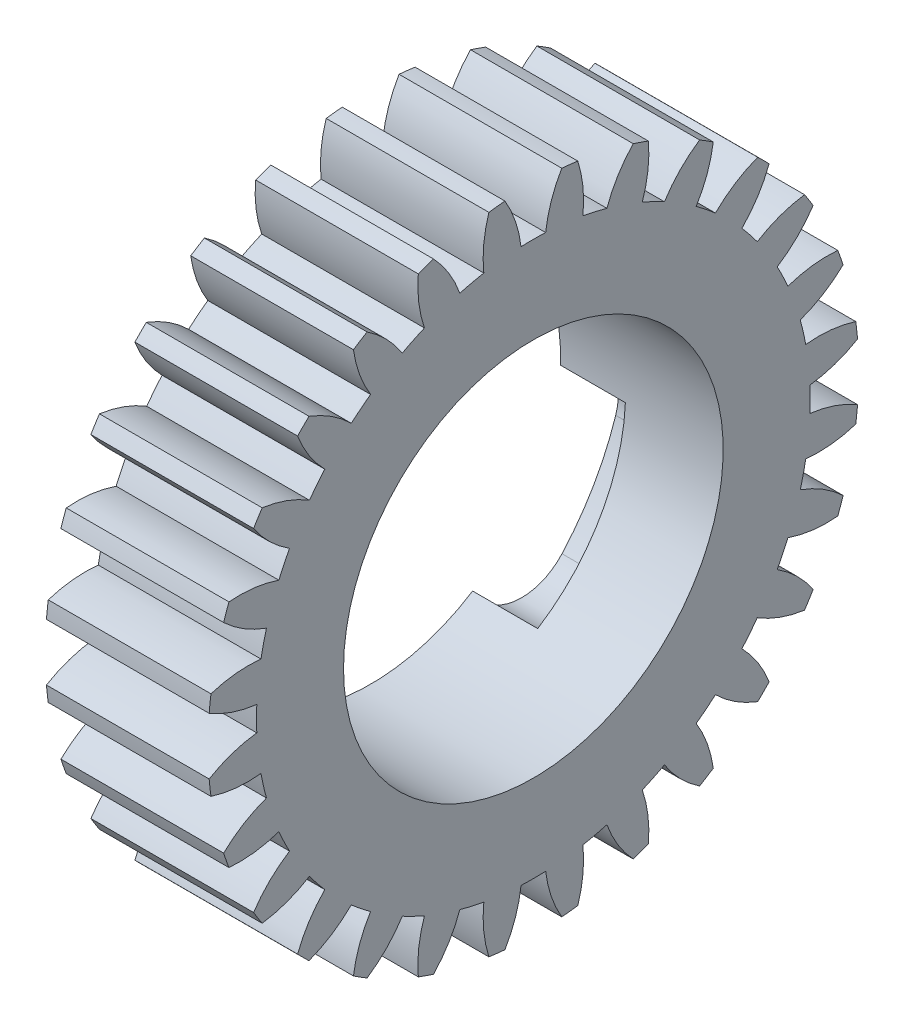
from build123d import *

# Parameters (mm, degrees)
SPUR_START             = -39.976574344
SPUR_GEAR_AI_OUTLINE_R = 11.1125
SPUR_GEAR_AI_DEPTH     = 9.525
CUT_EXTRUDE1_DEPTH     = 3.81
FILLET1_R              = 3.175


# Read off the part's stored shape, not the designer's step: spur gear_ai
with BuildPart() as part:
    # spur gear_ai outline → spur gear_ai (new body)
    with BuildSketch(Plane.YZ.offset(SPUR_START)):
        with BuildLine():
            ThreePointArc((23.018012861, 10.828162447), (23.179360033, 11.271572893), (23.329675625, 11.718843456))
            ThreePointArc((23.329675625, 11.718843456), (22.156058235, 12.619945917), (20.821383651, 13.258700312))
            ThreePointArc((20.821383651, 13.258700312), (20.997284393, 13.957392784), (21.141954603, 14.663213422))
            ThreePointArc((21.141954603, 14.663213422), (22.621599998, 14.659617646), (24.069966434, 14.96226941))
            ThreePointArc((24.069966434, 14.96226941), (24.128600189, 15.430465753), (24.175619992, 15.899970675))
            ThreePointArc((24.175619992, 15.899970675), (22.83091348, 16.517326179), (21.387565749, 16.843072632))
            ThreePointArc((21.387565749, 16.843072632), (21.40358259, 17.563389023), (21.387565749, 18.283705414))
            ThreePointArc((21.387565749, 18.283705414), (22.83091348, 18.609451867), (24.175619992, 19.226807371))
            ThreePointArc((24.175619992, 19.226807371), (24.128600189, 19.696312293), (24.069966434, 20.164508637))
            ThreePointArc((24.069966434, 20.164508637), (22.621599998, 20.4671604), (21.141954603, 20.463564625))
            ThreePointArc((21.141954603, 20.463564625), (20.997284393, 21.169385262), (20.821383651, 21.868077734))
            ThreePointArc((20.821383651, 21.868077734), (22.156058236, 22.506832129), (23.329675625, 23.407934591))
            ThreePointArc((23.329675625, 23.407934591), (23.179360033, 23.855205153), (23.018012861, 24.298615599))
            ThreePointArc((23.018012861, 24.298615599), (21.538613642, 24.271387399), (20.096866182, 23.938629702))
            ThreePointArc((20.096866182, 23.938629702), (19.798763289, 24.594561792), (19.471799044, 25.236594988))
            ThreePointArc((19.471799044, 25.236594988), (20.630874326, 26.156327512), (21.574552516, 27.295991891))
            ThreePointArc((21.574552516, 27.295991891), (21.328478586, 27.698600081), (21.072508617, 28.094990178))
            ThreePointArc((21.072508617, 28.094990178), (19.63625987, 27.739247349), (18.304705583, 27.094013591))
            ThreePointArc((18.304705583, 27.094013591), (17.86811813, 27.66716596), (17.406485735, 28.220345654))
            ThreePointArc((17.406485735, 28.220345654), (18.331840839, 29.374937077), (18.998259865, 30.696015843))
            ThreePointArc((18.998259865, 30.696015843), (18.668766772, 31.033773205), (18.331009411, 31.363266298))
            ThreePointArc((18.331009411, 31.363266298), (17.009930645, 30.696847272), (15.855339222, 29.771492168))
            ThreePointArc((15.855339222, 29.771492168), (15.302159528, 30.233124563), (14.729007159, 30.669712016))
            ThreePointArc((14.729007159, 30.669712016), (15.374240917, 32.001266303), (15.729983745, 33.43751505))
            ThreePointArc((15.729983745, 33.43751505), (15.333593648, 33.693485018), (14.930985458, 33.939558948))
            ThreePointArc((14.930985458, 33.939558948), (13.791321079, 32.995880758), (12.871588556, 31.836805477))
            ThreePointArc((12.871588556, 31.836805477), (12.229555359, 32.163769721), (11.573623269, 32.461872615))
            ThreePointArc((11.573623269, 32.461872615), (11.906380966, 33.903620075), (11.933609167, 35.383019293))
            ThreePointArc((11.933609167, 35.383019293), (11.490198721, 35.544366466), (11.042928158, 35.694682058))
            ThreePointArc((11.042928158, 35.694682058), (10.141825696, 34.521064669), (9.503071302, 33.186390084))
            ThreePointArc((9.503071302, 33.186390084), (8.80437883, 33.362290826), (8.098558192, 33.506961036))
            ThreePointArc((8.098558192, 33.506961036), (8.102153967, 34.98660643), (7.799502204, 36.434972866))
            ThreePointArc((7.799502204, 36.434972866), (7.33130586, 36.493606622), (6.861800938, 36.540626425))
            ThreePointArc((6.861800938, 36.540626425), (6.244445435, 35.195919912), (5.918698981, 33.752572182))
            ThreePointArc((5.918698981, 33.752572182), (5.19838259, 33.768589023), (4.4780662, 33.752572182))
            ThreePointArc((4.4780662, 33.752572182), (4.152319746, 35.195919912), (3.534964243, 36.540626425))
            ThreePointArc((3.534964243, 36.540626425), (3.065459321, 36.493606622), (2.597262977, 36.434972866))
            ThreePointArc((2.597262977, 36.434972866), (2.294611214, 34.98660643), (2.298206989, 33.506961036))
            ThreePointArc((2.298206989, 33.506961036), (1.592386351, 33.362290826), (0.893693879, 33.186390084))
            ThreePointArc((0.893693879, 33.186390084), (0.254939484, 34.521064668), (-0.646162977, 35.694682058))
            ThreePointArc((-0.646162977, 35.694682058), (-1.09343354, 35.544366466), (-1.536843986, 35.383019293))
            ThreePointArc((-1.536843986, 35.383019293), (-1.509615785, 33.903620075), (-1.176858088, 32.461872615))
            ThreePointArc((-1.176858088, 32.461872615), (-1.832790178, 32.163769721), (-2.474823375, 31.836805477))
            ThreePointArc((-2.474823375, 31.836805477), (-3.394555898, 32.995880758), (-4.534220277, 33.939558948))
            ThreePointArc((-4.534220277, 33.939558948), (-4.936828467, 33.693485018), (-5.333218564, 33.43751505))
            ThreePointArc((-5.333218564, 33.43751505), (-4.977475736, 32.001266303), (-4.332241978, 30.669712016))
            ThreePointArc((-4.332241978, 30.669712016), (-4.905394347, 30.233124563), (-5.458574041, 29.771492168))
            ThreePointArc((-5.458574041, 29.771492168), (-6.613165464, 30.696847272), (-7.93424423, 31.363266298))
            ThreePointArc((-7.93424423, 31.363266298), (-8.272001591, 31.033773205), (-8.601494684, 30.696015843))
            ThreePointArc((-8.601494684, 30.696015843), (-7.935075658, 29.374937077), (-7.009720554, 28.220345654))
            ThreePointArc((-7.009720554, 28.220345654), (-7.471352949, 27.66716596), (-7.907940402, 27.094013591))
            ThreePointArc((-7.907940402, 27.094013591), (-9.239494689, 27.739247349), (-10.675743436, 28.094990178))
            ThreePointArc((-10.675743436, 28.094990178), (-10.931713405, 27.698600081), (-11.177787335, 27.295991891))
            ThreePointArc((-11.177787335, 27.295991891), (-10.234109145, 26.156327512), (-9.075033863, 25.236594988))
            ThreePointArc((-9.075033863, 25.236594988), (-9.401998108, 24.594561792), (-9.700101001, 23.938629702))
            ThreePointArc((-9.700101001, 23.938629702), (-11.141848461, 24.271387399), (-12.62124768, 24.298615599))
            ThreePointArc((-12.62124768, 24.298615599), (-12.782594852, 23.855205153), (-12.932910444, 23.407934591))
            ThreePointArc((-12.932910444, 23.407934591), (-11.759293055, 22.506832129), (-10.42461847, 21.868077734))
            ThreePointArc((-10.42461847, 21.868077734), (-10.600519212, 21.169385262), (-10.745189422, 20.463564625))
            ThreePointArc((-10.745189422, 20.463564625), (-12.224834817, 20.4671604), (-13.673201253, 20.164508637))
            ThreePointArc((-13.673201253, 20.164508637), (-13.731835008, 19.696312293), (-13.778854811, 19.226807371))
            ThreePointArc((-13.778854811, 19.226807371), (-12.434148299, 18.609451867), (-10.990800568, 18.283705414))
            ThreePointArc((-10.990800568, 18.283705414), (-11.00681741, 17.563389023), (-10.990800568, 16.843072632))
            ThreePointArc((-10.990800568, 16.843072632), (-12.434148299, 16.517326179), (-13.778854811, 15.899970675))
            ThreePointArc((-13.778854811, 15.899970675), (-13.731835008, 15.430465753), (-13.673201253, 14.96226941))
            ThreePointArc((-13.673201253, 14.96226941), (-12.224834817, 14.659617646), (-10.745189422, 14.663213422))
            ThreePointArc((-10.745189422, 14.663213422), (-10.600519212, 13.957392784), (-10.42461847, 13.258700312))
            ThreePointArc((-10.42461847, 13.258700312), (-11.759293054, 12.619945917), (-12.932910444, 11.718843456))
            ThreePointArc((-12.932910444, 11.718843456), (-12.782594852, 11.271572893), (-12.62124768, 10.828162447))
            ThreePointArc((-12.62124768, 10.828162447), (-11.141848461, 10.855390647), (-9.700101001, 11.188148344))
            ThreePointArc((-9.700101001, 11.188148344), (-9.401998108, 10.532216254), (-9.075033863, 9.890183058))
            ThreePointArc((-9.075033863, 9.890183058), (-10.234109145, 8.970450535), (-11.177787335, 7.830786156))
            ThreePointArc((-11.177787335, 7.830786156), (-10.931713405, 7.428177966), (-10.675743436, 7.031787869))
            ThreePointArc((-10.675743436, 7.031787869), (-9.239494689, 7.387530697), (-7.907940402, 8.032764455))
            ThreePointArc((-7.907940402, 8.032764455), (-7.471352949, 7.459612086), (-7.009720554, 6.906432392))
            ThreePointArc((-7.009720554, 6.906432392), (-7.935075659, 5.751840969), (-8.601494684, 4.430762203))
            ThreePointArc((-8.601494684, 4.430762203), (-8.272001591, 4.093004842), (-7.93424423, 3.763511748))
            ThreePointArc((-7.93424423, 3.763511748), (-6.613165464, 4.429930774), (-5.458574041, 5.355285878))
            ThreePointArc((-5.458574041, 5.355285878), (-4.905394347, 4.893653483), (-4.332241978, 4.457066031))
            ThreePointArc((-4.332241978, 4.457066031), (-4.977475736, 3.125511743), (-5.333218564, 1.689262996))
            ThreePointArc((-5.333218564, 1.689262996), (-4.936828467, 1.433293028), (-4.534220277, 1.187219098))
            ThreePointArc((-4.534220277, 1.187219098), (-3.394555898, 2.130897288), (-2.474823375, 3.28997257))
            ThreePointArc((-2.474823375, 3.28997257), (-1.832790179, 2.963008325), (-1.176858088, 2.664905432))
            ThreePointArc((-1.176858088, 2.664905432), (-1.509615785, 1.223157972), (-1.536843986, -0.256241247))
            ThreePointArc((-1.536843986, -0.256241247), (-1.09343354, -0.417588419), (-0.646162977, -0.567904012))
            ThreePointArc((-0.646162977, -0.567904012), (0.254939484, 0.605713378), (0.893693879, 1.940387963))
            ThreePointArc((0.893693879, 1.940387963), (1.592386351, 1.764487221), (2.298206989, 1.619817011))
            ThreePointArc((2.298206989, 1.619817011), (2.294611214, 0.140171616), (2.597262977, -1.30819482))
            ThreePointArc((2.597262977, -1.30819482), (3.065459321, -1.366828575), (3.534964243, -1.413848379))
            ThreePointArc((3.534964243, -1.413848379), (4.152319746, -0.069141866), (4.4780662, 1.374205865))
            ThreePointArc((4.4780662, 1.374205865), (5.19838259, 1.358189023), (5.918698981, 1.374205865))
            ThreePointArc((5.918698981, 1.374205865), (6.244445435, -0.069141866), (6.861800938, -1.413848379))
            ThreePointArc((6.861800938, -1.413848379), (7.33130586, -1.366828575), (7.799502204, -1.30819482))
            ThreePointArc((7.799502204, -1.30819482), (8.102153967, 0.140171616), (8.098558192, 1.619817011))
            ThreePointArc((8.098558192, 1.619817011), (8.80437883, 1.764487221), (9.503071302, 1.940387963))
            ThreePointArc((9.503071302, 1.940387963), (10.141825696, 0.605713378), (11.042928158, -0.567904012))
            ThreePointArc((11.042928158, -0.567904012), (11.490198721, -0.417588419), (11.933609167, -0.256241247))
            ThreePointArc((11.933609167, -0.256241247), (11.906380966, 1.223157972), (11.573623269, 2.664905432))
            ThreePointArc((11.573623269, 2.664905432), (12.22955536, 2.963008325), (12.871588556, 3.28997257))
            ThreePointArc((12.871588556, 3.28997257), (13.791321079, 2.130897288), (14.930985458, 1.187219098))
            ThreePointArc((14.930985458, 1.187219098), (15.333593648, 1.433293028), (15.729983745, 1.689262996))
            ThreePointArc((15.729983745, 1.689262996), (15.374240917, 3.125511743), (14.729007159, 4.457066031))
            ThreePointArc((14.729007159, 4.457066031), (15.302159528, 4.893653483), (15.855339222, 5.355285878))
            ThreePointArc((15.855339222, 5.355285878), (17.009930645, 4.429930774), (18.331009411, 3.763511748))
            ThreePointArc((18.331009411, 3.763511748), (18.668766772, 4.093004842), (18.998259865, 4.430762203))
            ThreePointArc((18.998259865, 4.430762203), (18.33184084, 5.751840969), (17.406485735, 6.906432392))
            ThreePointArc((17.406485735, 6.906432392), (17.86811813, 7.459612086), (18.304705583, 8.032764455))
            ThreePointArc((18.304705583, 8.032764455), (19.63625987, 7.387530697), (21.072508617, 7.031787869))
            ThreePointArc((21.072508617, 7.031787869), (21.328478586, 7.428177966), (21.574552516, 7.830786156))
            ThreePointArc((21.574552516, 7.830786156), (20.630874326, 8.970450535), (19.471799044, 9.890183058))
            ThreePointArc((19.471799044, 9.890183058), (19.798763289, 10.532216254), (20.096866182, 11.188148344))
            ThreePointArc((20.096866182, 11.188148344), (21.538613642, 10.855390647), (23.018012861, 10.828162447))
        make_face()
        with Locations((5.19838259, 17.563389023)):
            Circle(SPUR_GEAR_AI_OUTLINE_R, mode=Mode.SUBTRACT)
    extrude(amount=SPUR_GEAR_AI_DEPTH)

    # Sketch1 → Cut-Extrude1 (cut)
    with BuildSketch(Plane.ZY.offset(39.976574344)):
        with BuildLine():
            Line((10.59964275, 18.575614718), (12.432207559, 15.055290474))
            ThreePointArc((12.432207559, 15.055290474), (17.563389023, 16.31088259), (22.694570488, 15.055290474))
            Line((22.694570488, 15.055290474), (24.527135296, 18.575614718))
            ThreePointArc((24.527135296, 18.575614718), (17.563389023, 20.27963259), (10.59964275, 18.575614718))
        make_face()
        with BuildLine():
            Line((32.630285015, 4.540547705), (28.665312385, 4.713662148))
            ThreePointArc((28.665312385, 4.713662148), (27.187096323, -0.35786741), (23.534130921, -4.173804851))
            Line((23.534130921, -4.173804851), (25.666538742, -7.521014652))
            ThreePointArc((25.666538742, -7.521014652), (30.624134644, -2.34224241), (32.630285015, 4.540547705))
        make_face()
        with BuildLine():
            ThreePointArc((11.592647125, -4.173804851), (7.939681724, -0.35786741), (6.461465661, 4.713662148))
            Line((6.461465661, 4.713662148), (2.496493031, 4.540547705))
            ThreePointArc((2.496493031, 4.540547705), (4.502643402, -2.34224241), (9.460239305, -7.521014652))
            Line((9.460239305, -7.521014652), (11.592647125, -4.173804851))
        make_face()
    extrude(amount=-CUT_EXTRUDE1_DEPTH, mode=Mode.SUBTRACT)

    # Fillet1
    fillet1_edges = [part.edges().sort_by_distance(p)[0] for p in [
        (-38.071574344, 18.575614718, 24.527135296),
        (-38.071574344, 18.575614718, 10.59964275),
        (-38.071574344, -7.521014652, 25.666538742),
        (-38.071574344, 4.540547705, 32.630285015),
        (-38.071574344, 4.540547705, 2.496493031),
        (-38.071574344, -7.521014652, 9.460239305),
    ]]
    fillet(fillet1_edges, radius=FILLET1_R)


solid = part.part
